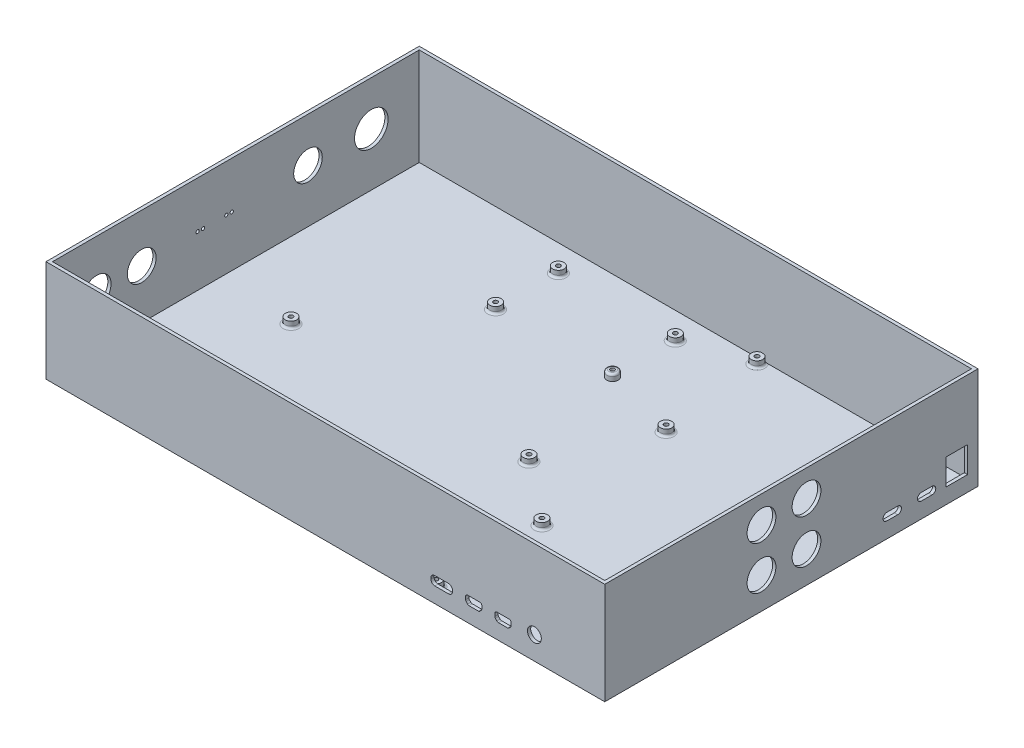
from build123d import *

# Parameters (mm, degrees)
BOSS_EXTRUDE1_START      = 4
SKETCH1_W                = 255
SKETCH1_H                = 169.340000001
BOSS_EXTRUDE1_DEPTH      = 2
BOSS_EXTRUDE2_DEPTH      = 45
BOSS_EXTRUDE2_DEPTH_BACK = 2
SKETCH2_W                = 258
SKETCH2_H                = 172.340000001
SKETCH2_W_2              = 255
SKETCH2_H_2              = 169.340000001
SKETCH3_R                = 3.2
CUT_EXTRUDE1_DEPTH       = 30
SKETCH4_W                = 10
SKETCH4_H                = 12
CUT_EXTRUDE2_DEPTH       = 30
SKETCH5_R                = 6.65
CUT_EXTRUDE4_DEPTH       = 30
SKETCH6_R                = 6.65
SKETCH6_R_2              = 0.75
SKETCH6_R_3              = 6.6
SKETCH6_R_4              = 7.75
CUT_EXTRUDE6_DEPTH       = 30
SKETCH7_R                = 2.618985938
SKETCH7_R_2              = 0.984609571
BOSS_EXTRUDE3_DEPTH      = 3
FILLET1_R                = 1


with BuildPart() as part:
    # Sketch1 → Boss-Extrude1 (new body)
    with BuildSketch(Plane.XZ.offset(BOSS_EXTRUDE1_START)):
        with Locations((-46.517927732, 10.919190253)):
            Rectangle(SKETCH1_W, SKETCH1_H)
    extrude(amount=BOSS_EXTRUDE1_DEPTH)

    # Sketch2 → Boss-Extrude2 (add, two sides: drawn at the far end of the back side and taken through both)
    with BuildSketch(Plane(origin=(0, -4, 0), x_dir=(1, 0, 0), z_dir=(0, 1, 0)).offset(-BOSS_EXTRUDE2_DEPTH_BACK)):
        with Locations((-46.517927732, -10.919190253)):
            Rectangle(SKETCH2_W, SKETCH2_H)
        with Locations((-46.517927732, -10.919190253)):
            Rectangle(SKETCH2_W_2, SKETCH2_H_2, mode=Mode.SUBTRACT)
    extrude(amount=BOSS_EXTRUDE2_DEPTH + BOSS_EXTRUDE2_DEPTH_BACK)

    # Sketch3 → Cut-Extrude1 (cut)
    with BuildSketch(Plane.XY.offset(97.089190253)):
        with Locations((49.982072268, 4.6)):
            Circle(SKETCH3_R)
        with BuildLine():
            Line((4.012072268, 1.1), (10.352072268, 1.1))
            ThreePointArc((10.352072268, 1.1), (11.624864474, 1.627207794), (12.152072268, 2.9))
            Line((12.152072268, 2.9), (12.152072268, 3.46))
            ThreePointArc((12.152072268, 3.46), (11.624864474, 4.732792206), (10.352072268, 5.26))
            Line((10.352072268, 5.26), (4.012072268, 5.26))
            ThreePointArc((4.012072268, 5.26), (2.739280062, 4.732792206), (2.212072268, 3.46))
            Line((2.212072268, 3.46), (2.212072268, 2.9))
            ThreePointArc((2.212072268, 2.9), (2.739280062, 1.627207794), (4.012072268, 1.1))
        make_face()
        with BuildLine():
            Line((21.822072159, 1.1), (19.82656004, 1.1))
            ThreePointArc((19.82656004, 1.1), (19.451343724, 1.177238454), (19.137140309, 1.396394282))
            Line((19.137140309, 1.396394282), (18.492652538, 2.076196452))
            ThreePointArc((18.492652538, 2.076196452), (18.299618659, 2.377984564), (18.232072268, 2.72980217))
            Line((18.232072268, 2.72980217), (18.232072268, 4.05))
            ThreePointArc((18.232072268, 4.05), (18.510320826, 4.721751442), (19.182072268, 5))
            Line((19.182072268, 5), (24.782072268, 5))
            ThreePointArc((24.782072268, 5), (25.45382371, 4.721751442), (25.732072268, 4.05))
            Line((25.732072268, 4.05), (25.732072268, 2.72980217))
            ThreePointArc((25.732072268, 2.72980217), (25.664525877, 2.377984564), (25.471491998, 2.076196452))
            Line((25.471491998, 2.076196452), (24.827004227, 1.396394282))
            ThreePointArc((24.827004227, 1.396394282), (24.512800812, 1.177238454), (24.137584496, 1.1))
            Line((24.137584496, 1.1), (22.142072159, 1.1))
            Line((22.142072159, 1.1), (21.822072159, 1.1))
        make_face()
        with BuildLine():
            Line((35.642072159, 1.1), (35.322072159, 1.1))
            Line((35.322072159, 1.1), (33.32656004, 1.1))
            ThreePointArc((33.32656004, 1.1), (32.951343724, 1.177238454), (32.637140309, 1.396394282))
            Line((32.637140309, 1.396394282), (31.992652538, 2.076196452))
            ThreePointArc((31.992652538, 2.076196452), (31.799618659, 2.377984564), (31.732072268, 2.72980217))
            Line((31.732072268, 2.72980217), (31.732072268, 4.05))
            ThreePointArc((31.732072268, 4.05), (32.010320826, 4.721751442), (32.682072268, 5))
            Line((32.682072268, 5), (38.282072268, 5))
            ThreePointArc((38.282072268, 5), (38.95382371, 4.721751442), (39.232072268, 4.05))
            Line((39.232072268, 4.05), (39.232072268, 2.72980217))
            ThreePointArc((39.232072268, 2.72980217), (39.164525877, 2.377984564), (38.971491998, 2.076196452))
            Line((38.971491998, 2.076196452), (38.327004227, 1.396394282))
            ThreePointArc((38.327004227, 1.396394282), (38.012800812, 1.177238454), (37.637584496, 1.1))
            Line((37.637584496, 1.1), (35.642072159, 1.1))
        make_face()
    extrude(amount=-CUT_EXTRUDE1_DEPTH, mode=Mode.SUBTRACT)

    # Sketch4 → Cut-Extrude2 (cut)
    with BuildSketch(Plane(origin=(82.482072268, 0, 0), x_dir=(0, 0, -1), z_dir=(1, 0, 0))):
        with BuildLine():
            Line((49.025809748, 4.644980746), (54.025809748, 4.644980746))
            ThreePointArc((54.025809748, 4.644980746), (55.750484565, 2.920305929), (54.025809748, 1.195631111))
            Line((54.025809748, 1.195631111), (49.025809748, 1.195631111))
            ThreePointArc((49.025809748, 1.195631111), (47.30113493, 2.920305929), (49.025809748, 4.644980746))
        make_face()
        with BuildLine():
            Line((38.150809748, 4.644980746), (33.150809748, 4.644980746))
            ThreePointArc((33.150809748, 4.644980746), (31.42613493, 2.920305929), (33.150809748, 1.195631111))
            Line((33.150809748, 1.195631111), (38.150809748, 1.195631111))
            ThreePointArc((38.150809748, 1.195631111), (39.875484565, 2.920305929), (38.150809748, 4.644980746))
        make_face()
        with Locations((65.448809748, 7.1)):
            Rectangle(SKETCH4_W, SKETCH4_H)
    extrude(amount=-CUT_EXTRUDE2_DEPTH, mode=Mode.SUBTRACT)

    # Sketch5 → Cut-Extrude4 (cut)
    with BuildSketch(Plane(origin=(82.482072268, 0, 0), x_dir=(0, 0, -1), z_dir=(1, 0, 0))):
        with Locations((-24.72976609, 28.504248458)):
            Circle(SKETCH5_R)
        with Locations((-24.72976609, 8.504248458)):
            Circle(SKETCH5_R)
        with Locations((-3.92976609, 8.504248458)):
            Circle(SKETCH5_R)
        with BuildLine():
            ThreePointArc((-3.92976609, 35.345751542), (-10.57976609, 28.695751542), (-3.92976609, 22.045751542))
            ThreePointArc((-3.92976609, 22.045751542), (2.72023391, 28.695751542), (-3.92976609, 35.345751542))
        make_face()
    extrude(amount=-CUT_EXTRUDE4_DEPTH, mode=Mode.SUBTRACT)

    # Sketch6 → Cut-Extrude6 (cut)
    with BuildSketch(Plane(origin=(-174.017927732, 0, 0), x_dir=(0, 0, -1), z_dir=(1, 0, 0))):
        with Locations((-54.389190253, 18.695751542)):
            Circle(SKETCH6_R)
        with Locations((-28.606987613, 19.5014)):
            Circle(SKETCH6_R_2)
        with Locations((-26.066987613, 19.5014)):
            Circle(SKETCH6_R_2)
        with Locations((-12.805020205, 19.5014)):
            Circle(SKETCH6_R_2)
        with Locations((-15.345020205, 19.5014)):
            Circle(SKETCH6_R_2)
        with Locations((-75.189190253, 18.695751542)):
            Circle(SKETCH6_R)
        with Locations((22.377743462, 20.5)):
            Circle(SKETCH6_R_3)
        with Locations((51.626454095, 20.5)):
            Circle(SKETCH6_R_4)
    extrude(amount=-CUT_EXTRUDE6_DEPTH, mode=Mode.SUBTRACT)

    # Sketch7 → Boss-Extrude3 (add)
    # profile 1 of 16: a face of its own
    with BuildSketch(Plane(origin=(0, -4, 0), x_dir=(1, 0, 0), z_dir=(0, 1, 0))):
        with Locations(Location((-29.017927732, -90.589190253, 0), (0, 0, 270))):
            Circle(SKETCH7_R)
        with Locations(Location((-29.017927732, -90.589190253, 0), (0, 0, 270))):
            Circle(SKETCH7_R_2, mode=Mode.SUBTRACT)
    # profile 2 of 16: a face of its own
    with BuildSketch(Plane(origin=(0, -4, 0), x_dir=(1, 0, 0), z_dir=(0, 1, 0))):
        with Locations(Location((-0.517927732, -43.089190253, 0), (0, 0, 270))):
            Circle(SKETCH7_R)
        with Locations(Location((-0.517927732, -43.089190253, 0), (0, 0, 270))):
            Circle(SKETCH7_R_2, mode=Mode.SUBTRACT)
    # profile 3 of 16: a face of its own
    with BuildSketch(Plane(origin=(0, -4, 0), x_dir=(1, 0, 0), z_dir=(0, 1, 0))):
        with Locations(Location((57.482072268, -43.089190253, 0), (0, 0, 270))):
            Circle(SKETCH7_R)
        with Locations(Location((57.482072268, -43.089190253, 0), (0, 0, 270))):
            Circle(SKETCH7_R_2, mode=Mode.SUBTRACT)
    # profile 4 of 16: a face of its own
    with BuildSketch(Plane(origin=(0, -4, 0), x_dir=(1, 0, 0), z_dir=(0, 1, 0))):
        with Locations(Location((65.742072268, 22.95080396, 0), (0, 0, 270))):
            Circle(SKETCH7_R)
        with Locations(Location((65.742072268, 22.95080396, 0), (0, 0, 270))):
            Circle(SKETCH7_R_2, mode=Mode.SUBTRACT)
    # profile 5 of 16: a face of its own
    with BuildSketch(Plane(origin=(0, -4, 0), x_dir=(1, 0, 0), z_dir=(0, 1, 0))):
        with Locations((67.012072268, 71.21080396)):
            Circle(SKETCH7_R)
        with Locations(Location((67.012072268, 71.21080396, 0), (0, 0, 270))):
            Circle(SKETCH7_R_2, mode=Mode.SUBTRACT)
    # profile 6 of 16: a face of its own
    with BuildSketch(Plane(origin=(0, -4, 0), x_dir=(1, 0, 0), z_dir=(0, 1, 0))):
        with Locations(Location((-29.017927732, -20.589190253, 0), (0, 0, 270))):
            Circle(SKETCH7_R)
        with Locations(Location((-29.017927732, -20.589190253, 0), (0, 0, 270))):
            Circle(SKETCH7_R_2, mode=Mode.SUBTRACT)
    # profile 7 of 16: a face of its own
    with BuildSketch(Plane(origin=(0, -4, 0), x_dir=(1, 0, 0), z_dir=(0, 1, 0))):
        with Locations(Location((-9.22924426, 22.95080396, 0), (0, 0, 270))):
            Circle(SKETCH7_R)
        with Locations(Location((-9.22924426, 22.95080396, 0), (0, 0, 270))):
            Circle(SKETCH7_R_2, mode=Mode.SUBTRACT)
    # profile 8 of 16: a face of its own
    with BuildSketch(Plane(origin=(0, -4, 0), x_dir=(1, 0, 0), z_dir=(0, 1, 0))):
        with Locations(Location((-43.617927732, 32.580809747, 0), (0, 0, 270))):
            Circle(SKETCH7_R)
        with Locations(Location((-43.617927732, 32.580809747, 0), (0, 0, 270))):
            Circle(SKETCH7_R_2, mode=Mode.SUBTRACT)
    # profile 9 of 16: a face of its own
    with BuildSketch(Plane(origin=(0, -4, 0), x_dir=(1, 0, 0), z_dir=(0, 1, 0))):
        with Locations(Location((-43.617927732, 61.580809747, 0), (0, 0, 270))):
            Circle(SKETCH7_R)
        with Locations(Location((-43.617927732, 61.580809747, 0), (0, 0, 270))):
            Circle(SKETCH7_R_2, mode=Mode.SUBTRACT)
    # profile 10 of 16: a face of its own
    with BuildSketch(Plane(origin=(0, -4, 0), x_dir=(1, 0, 0), z_dir=(0, 1, 0))):
        with Locations(Location((-97.617927732, 32.580809747, 0), (0, 0, 270))):
            Circle(SKETCH7_R)
        with Locations(Location((-97.617927732, 32.580809747, 0), (0, 0, 270))):
            Circle(SKETCH7_R_2, mode=Mode.SUBTRACT)
    # profile 11 of 16: a face of its own
    with BuildSketch(Plane(origin=(0, -4, 0), x_dir=(1, 0, 0), z_dir=(0, 1, 0))):
        with Locations(Location((-97.617927732, 61.580809747, 0), (0, 0, 270))):
            Circle(SKETCH7_R)
        with Locations(Location((-97.617927732, 61.580809747, 0), (0, 0, 270))):
            Circle(SKETCH7_R_2, mode=Mode.SUBTRACT)
    # profile 12 of 16: a face of its own
    with BuildSketch(Plane(origin=(0, -4, 0), x_dir=(1, 0, 0), z_dir=(0, 1, 0))):
        with Locations(Location((-139.017927732, -20.474689441, 0), (0, 0, 270))):
            Circle(SKETCH7_R)
        with Locations(Location((-139.017927732, -20.474689441, 0), (0, 0, 270))):
            Circle(SKETCH7_R_2, mode=Mode.SUBTRACT)
    # profile 13 of 16: a face of its own
    with BuildSketch(Plane(origin=(0, -4, 0), x_dir=(1, 0, 0), z_dir=(0, 1, 0))):
        with Locations(Location((-139.017927732, -90.589190253, 0), (0, 0, 270))):
            Circle(SKETCH7_R)
        with Locations(Location((-139.017927732, -90.589190253, 0), (0, 0, 270))):
            Circle(SKETCH7_R_2, mode=Mode.SUBTRACT)
    # profile 14 of 16: a face of its own
    with BuildSketch(Plane(origin=(0, -4, 0), x_dir=(1, 0, 0), z_dir=(0, 1, 0))):
        with Locations((-15.537927732, 71.21080396)):
            Circle(SKETCH7_R)
        with Locations(Location((-15.537927732, 71.21080396, 0), (0, 0, 270))):
            Circle(SKETCH7_R_2, mode=Mode.SUBTRACT)
    # profile 15 of 16: a face of its own
    with BuildSketch(Plane(origin=(0, -4, 0), x_dir=(1, 0, 0), z_dir=(0, 1, 0))):
        with Locations(Location((-0.517927732, -92.089190253, 0), (0, 0, 270))):
            Circle(SKETCH7_R)
        with Locations(Location((-0.517927732, -92.089190253, 0), (0, 0, 270))):
            Circle(SKETCH7_R_2, mode=Mode.SUBTRACT)
    # profile 16 of 16: a face of its own
    with BuildSketch(Plane(origin=(0, -4, 0), x_dir=(1, 0, 0), z_dir=(0, 1, 0))):
        with Locations(Location((57.482072268, -92.089190253, 0), (0, 0, 270))):
            Circle(SKETCH7_R)
        with Locations(Location((57.482072268, -92.089190253, 0), (0, 0, 270))):
            Circle(SKETCH7_R_2, mode=Mode.SUBTRACT)
    extrude(amount=BOSS_EXTRUDE3_DEPTH)

    # Fillet1
    # the kernel refuses this fillet: 1 mm, written as the material it adds along each edge
    with BuildSketch(Plane(origin=(-29.017927732, -4, 90.589190253), x_dir=(0, 0, 1), z_dir=(-1, 0, 0))) as fillet1_piece_1:
        with BuildLine():
            CenterArc((2.618985938 + FILLET1_R, FILLET1_R), FILLET1_R, 180, 90)
            Line((2.618985938, FILLET1_R), (2.618985938, 0))
            Line((2.618985938, 0), (2.618985938 + FILLET1_R, 0))
        make_face()
    revolve(axis=Axis((-29.017927732, -4, 90.589190253), (0, 1, 0)))
    with BuildSketch(Plane(origin=(-0.517927732, -4, 43.089190253), x_dir=(0, 0, 1), z_dir=(-1, 0, 0))) as fillet1_piece_2:
        with BuildLine():
            CenterArc((2.618985938 + FILLET1_R, FILLET1_R), FILLET1_R, 180, 90)
            Line((2.618985938, FILLET1_R), (2.618985938, 0))
            Line((2.618985938, 0), (2.618985938 + FILLET1_R, 0))
        make_face()
    revolve(axis=Axis((-0.517927732, -4, 43.089190253), (0, 1, 0)))
    with BuildSketch(Plane(origin=(65.742072268, -4, -22.95080396), x_dir=(0, 0, 1), z_dir=(-1, 0, 0))) as fillet1_piece_3:
        with BuildLine():
            CenterArc((2.618985938 + FILLET1_R, FILLET1_R), FILLET1_R, 180, 90)
            Line((2.618985938, FILLET1_R), (2.618985938, 0))
            Line((2.618985938, 0), (2.618985938 + FILLET1_R, 0))
        make_face()
    revolve(axis=Axis((65.742072268, -4, -22.95080396), (0, 1, 0)))
    with BuildSketch(Plane(origin=(67.012072268, -4, -71.21080396), x_dir=(0.0031415874858811226, 0, -0.9999950652018582), z_dir=(-0.9999950652018582, 0, -0.0031415874858811226))) as fillet1_piece_4:
        with BuildLine():
            CenterArc((2.618985938 + FILLET1_R, -FILLET1_R), FILLET1_R, 90, 90)
            Line((2.618985938, -FILLET1_R), (2.618985938, 0))
            Line((2.618985938, 0), (2.618985938 + FILLET1_R, 0))
        make_face()
    revolve(axis=Axis((67.012072268, -4, -71.21080396), (0, -1, 0)), revolution_arc=359.64)
    with BuildSketch(Plane(origin=(-29.017927732, -4, 20.589190253), x_dir=(0, 0, 1), z_dir=(-1, 0, 0))) as fillet1_piece_5:
        with BuildLine():
            CenterArc((2.618985938 + FILLET1_R, FILLET1_R), FILLET1_R, 180, 90)
            Line((2.618985938, FILLET1_R), (2.618985938, 0))
            Line((2.618985938, 0), (2.618985938 + FILLET1_R, 0))
        make_face()
    revolve(axis=Axis((-29.017927732, -4, 20.589190253), (0, 1, 0)))
    with BuildSketch(Plane(origin=(-9.22924426, -4, -22.95080396), x_dir=(0, 0, 1), z_dir=(-1, 0, 0))) as fillet1_piece_6:
        with BuildLine():
            CenterArc((2.618985938 + FILLET1_R, FILLET1_R), FILLET1_R, 180, 90)
            Line((2.618985938, FILLET1_R), (2.618985938, 0))
            Line((2.618985938, 0), (2.618985938 + FILLET1_R, 0))
        make_face()
    revolve(axis=Axis((-9.22924426, -4, -22.95080396), (0, 1, 0)))
    with BuildSketch(Plane(origin=(-43.617927732, -4, -61.580809747), x_dir=(0, 0, 1), z_dir=(-1, 0, 0))) as fillet1_piece_7:
        with BuildLine():
            CenterArc((2.618985938 + FILLET1_R, FILLET1_R), FILLET1_R, 180, 90)
            Line((2.618985938, FILLET1_R), (2.618985938, 0))
            Line((2.618985938, 0), (2.618985938 + FILLET1_R, 0))
        make_face()
    revolve(axis=Axis((-43.617927732, -4, -61.580809747), (0, 1, 0)))
    with BuildSketch(Plane(origin=(-97.617927732, -4, -32.580809747), x_dir=(0, 0, 1), z_dir=(-1, 0, 0))) as fillet1_piece_8:
        with BuildLine():
            CenterArc((2.618985938 + FILLET1_R, FILLET1_R), FILLET1_R, 180, 90)
            Line((2.618985938, FILLET1_R), (2.618985938, 0))
            Line((2.618985938, 0), (2.618985938 + FILLET1_R, 0))
        make_face()
    revolve(axis=Axis((-97.617927732, -4, -32.580809747), (0, 1, 0)))
    with BuildSketch(Plane(origin=(-97.617927732, -4, -61.580809747), x_dir=(0, 0, 1), z_dir=(-1, 0, 0))) as fillet1_piece_9:
        with BuildLine():
            CenterArc((2.618985938 + FILLET1_R, FILLET1_R), FILLET1_R, 180, 90)
            Line((2.618985938, FILLET1_R), (2.618985938, 0))
            Line((2.618985938, 0), (2.618985938 + FILLET1_R, 0))
        make_face()
    revolve(axis=Axis((-97.617927732, -4, -61.580809747), (0, 1, 0)))
    with BuildSketch(Plane(origin=(-139.017927732, -4, 20.474689441), x_dir=(0, 0, 1), z_dir=(-1, 0, 0))) as fillet1_piece_10:
        with BuildLine():
            CenterArc((2.618985938 + FILLET1_R, FILLET1_R), FILLET1_R, 180, 90)
            Line((2.618985938, FILLET1_R), (2.618985938, 0))
            Line((2.618985938, 0), (2.618985938 + FILLET1_R, 0))
        make_face()
    revolve(axis=Axis((-139.017927732, -4, 20.474689441), (0, 1, 0)))
    with BuildSketch(Plane(origin=(-139.017927732, -4, 90.589190253), x_dir=(0, 0, 1), z_dir=(-1, 0, 0))) as fillet1_piece_11:
        with BuildLine():
            CenterArc((2.618985938 + FILLET1_R, FILLET1_R), FILLET1_R, 180, 90)
            Line((2.618985938, FILLET1_R), (2.618985938, 0))
            Line((2.618985938, 0), (2.618985938 + FILLET1_R, 0))
        make_face()
    revolve(axis=Axis((-139.017927732, -4, 90.589190253), (0, 1, 0)))
    with BuildSketch(Plane(origin=(-15.537927732, -4, -71.21080396), x_dir=(0.003141587485881818, 0, -0.9999950652018582), z_dir=(-0.9999950652018582, 0, -0.003141587485881818))) as fillet1_piece_12:
        with BuildLine():
            CenterArc((2.618985938 + FILLET1_R, -FILLET1_R), FILLET1_R, 90, 90)
            Line((2.618985938, -FILLET1_R), (2.618985938, 0))
            Line((2.618985938, 0), (2.618985938 + FILLET1_R, 0))
        make_face()
    revolve(axis=Axis((-15.537927732, -4, -71.21080396), (0, -1, 0)), revolution_arc=359.64)
    with BuildSketch(Plane(origin=(-0.517927732, -4, 92.089190253), x_dir=(0, 0, 1), z_dir=(-1, 0, 0))) as fillet1_piece_13:
        with BuildLine():
            CenterArc((2.618985938 + FILLET1_R, FILLET1_R), FILLET1_R, 180, 90)
            Line((2.618985938, FILLET1_R), (2.618985938, 0))
            Line((2.618985938, 0), (2.618985938 + FILLET1_R, 0))
        make_face()
    revolve(axis=Axis((-0.517927732, -4, 92.089190253), (0, 1, 0)))
    with BuildSketch(Plane(origin=(57.482072268, -4, 92.089190253), x_dir=(0, 0, 1), z_dir=(-1, 0, 0))) as fillet1_piece_14:
        with BuildLine():
            CenterArc((2.618985938 + FILLET1_R, FILLET1_R), FILLET1_R, 180, 90)
            Line((2.618985938, FILLET1_R), (2.618985938, 0))
            Line((2.618985938, 0), (2.618985938 + FILLET1_R, 0))
        make_face()
    revolve(axis=Axis((57.482072268, -4, 92.089190253), (0, 1, 0)))
    # the kernel refuses this fillet: 1 mm, written as the material it takes off along each edge
    with BuildSketch(Plane(origin=(57.482072268, -1, 43.089190253), x_dir=(0, 0, 1), z_dir=(-1, 0, 0))) as fillet1_2_piece_1:
        with BuildLine():
            CenterArc((2.618985938 - FILLET1_R, -FILLET1_R), FILLET1_R, 0, 90)
            Line((2.618985938 - FILLET1_R, 0), (2.618985938, 0))
            Line((2.618985938, 0), (2.618985938, -FILLET1_R))
        make_face()
    revolve(axis=Axis((57.482072268, -1, 43.089190253), (0, 1, 0)), mode=Mode.SUBTRACT)
    with BuildSketch(Plane(origin=(-43.617927732, -1, -32.580809747), x_dir=(0, 0, 1), z_dir=(-1, 0, 0))) as fillet1_2_piece_2:
        with BuildLine():
            CenterArc((2.618985938 - FILLET1_R, -FILLET1_R), FILLET1_R, 0, 90)
            Line((2.618985938 - FILLET1_R, 0), (2.618985938, 0))
            Line((2.618985938, 0), (2.618985938, -FILLET1_R))
        make_face()
    revolve(axis=Axis((-43.617927732, -1, -32.580809747), (0, 1, 0)), mode=Mode.SUBTRACT)


solid = part.part
